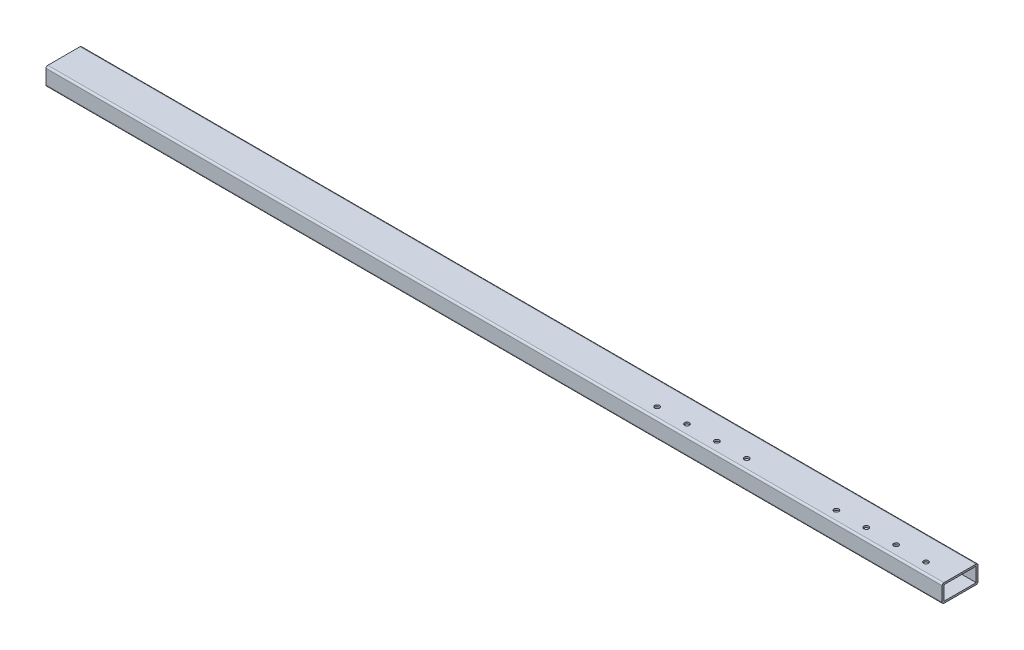
from build123d import *

# Parameters (mm, degrees)
SKETCH_1_W          = 54
SKETCH_1_H          = 24
EXTRUDE_1_DEPTH     = 1500
SKETCH_2_R          = 4.05
CUT_EXTRUDE_1_DEPTH = 1501.599880048


with BuildPart() as part:
    # Эскиз1 → Вытянуть-Тонкостенный1 (new body)
    with BuildSketch(Plane(origin=(0, 0, 0), x_dir=(0, 0, -1), z_dir=(1, 0, 0))):
        with BuildLine():
            Line((30, 12), (30, -12))
            ThreePointArc((30, -12), (29.121320344, -14.121320344), (27, -15))
            Line((27, -15), (-27, -15))
            ThreePointArc((-27, -15), (-29.121320344, -14.121320344), (-30, -12))
            Line((-30, -12), (-30, 12))
            ThreePointArc((-30, 12), (-29.121320344, 14.121320344), (-27, 15))
            Line((-27, 15), (27, 15))
            ThreePointArc((27, 15), (29.121320344, 14.121320344), (30, 12))
        make_face()
        Rectangle(SKETCH_1_W, SKETCH_1_H, mode=Mode.SUBTRACT)
    extrude(amount=EXTRUDE_1_DEPTH)

    # Эскиз2 → Вырез-Вытянуть1 (cut, through all)
    with BuildSketch(Plane(origin=(0, 15, 0), x_dir=(1, 0, 0), z_dir=(0, 1, 0))):
        with Locations((1455, -12)):
            Circle(SKETCH_2_R)
        with Locations((1405, -12)):
            Circle(SKETCH_2_R)
        with Locations((1355, -12)):
            Circle(SKETCH_2_R)
        with Locations((1305, -12)):
            Circle(SKETCH_2_R)
        with Locations((1155, -12)):
            Circle(SKETCH_2_R)
        with Locations((1105, -12)):
            Circle(SKETCH_2_R)
        with Locations((1055, -12)):
            Circle(SKETCH_2_R)
        with Locations((1005, -12)):
            Circle(SKETCH_2_R)
    extrude(amount=-CUT_EXTRUDE_1_DEPTH, mode=Mode.SUBTRACT)


solid = part.part
